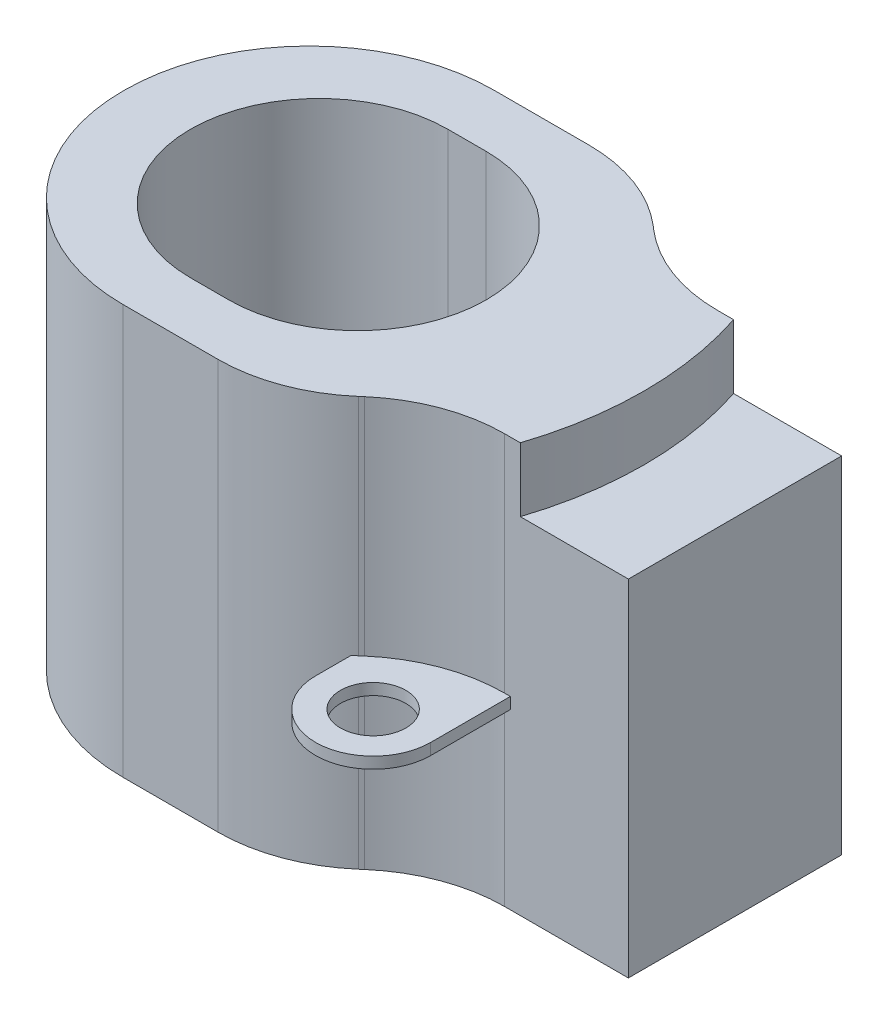
from build123d import *

# Parameters (mm, degrees)
BOSS_EXTRUDE1_DEPTH = 28.8
CUT_EXTRUDE1_DEPTH  = 43.16814556
CUT_EXTRUDE2_DEPTH  = 4.5
SKETCH4_R           = 2.3
BOSS_EXTRUDE2_DEPTH = 0.8


with BuildPart() as part:
    # Sketch1 → Boss-Extrude1 (new body)
    with BuildSketch(Plane(origin=(0, 0, 0), x_dir=(1, 0, 0), z_dir=(0, 1, 0))):
        with BuildLine():
            Line((12.001949565, -10.177539796), (11.776416687, -10.372460204))
            ThreePointArc((11.776416687, -10.372460204), (8.421105083, -12.358905428), (4.583596924, -13.05))
            Line((4.583596924, -13.05), (-2.1, -13.05))
            ThreePointArc((-2.1, -13.05), (-11.292388155, -9.242388155), (-15.1, -0.05))
            Line((-15.1, -0.05), (-15.1, 0.05))
            ThreePointArc((-15.1, 0.05), (-11.292388155, 9.242388155), (-2.1, 13.05))
            Line((-2.1, 13.05), (4.583596924, 13.05))
            ThreePointArc((4.583596924, 13.05), (8.421105083, 12.358905428), (11.776416687, 10.372460204))
            Line((11.776416687, 10.372460204), (12.001949565, 10.177539796))
            ThreePointArc((12.001949565, 10.177539796), (15.357261169, 8.191094572), (19.194769328, 7.5))
            Line((19.194769328, 7.5), (27.9, 7.5))
            Line((27.9, 7.5), (27.9, -7.5))
            Line((27.9, -7.5), (19.194769328, -7.5))
            ThreePointArc((19.194769328, -7.5), (15.357261169, -8.191094572), (12.001949565, -10.177539796))
        make_face()
    extrude(amount=-BOSS_EXTRUDE1_DEPTH)

    # Sketch2 → Cut-Extrude1 (cut, through all)
    with BuildSketch(Plane(origin=(0, 0, 0), x_dir=(1, 0, 0), z_dir=(0, 1, 0))):
        with BuildLine():
            Line((1.35, -9.05), (-1.35, -9.05))
            ThreePointArc((-1.35, -9.05), (-10.4, 0), (-1.35, 9.05))
            Line((-1.35, 9.05), (1.35, 9.05))
            ThreePointArc((1.35, 9.05), (10.4, 0), (1.35, -9.05))
        make_face()
    extrude(amount=-CUT_EXTRUDE1_DEPTH, mode=Mode.SUBTRACT)

    # Sketch3 → Cut-Extrude2 (cut)
    with BuildSketch(Plane(origin=(0, 0, 0), x_dir=(1, 0, 0), z_dir=(0, 1, 0))):
        with BuildLine():
            Line((27.9, 7.5), (20.3, 7.5))
            ThreePointArc((20.3, 7.5), (21.5, 0), (20.3, -7.5))
            Line((20.3, -7.5), (27.9, -7.5))
            Line((27.9, -7.5), (27.9, 7.5))
        make_face()
    extrude(amount=-CUT_EXTRUDE2_DEPTH, mode=Mode.SUBTRACT)

    # Sketch4 → Boss-Extrude2 (add)
    with BuildSketch(Plane(origin=(0, -15.8, 0), x_dir=(1, 0, 0), z_dir=(0, 1, 0))):
        with BuildLine():
            Line((19.6, 13.1), (19.6, -13.1))
            ThreePointArc((19.6, -13.1), (15.55, -17.15), (11.5, -13.1))
            Line((11.5, -13.1), (11.5, 13.1))
            ThreePointArc((11.5, 13.1), (15.55, 17.15), (19.6, 13.1))
        make_face()
        with Locations((15.55, 13.1)):
            Circle(SKETCH4_R, mode=Mode.SUBTRACT)
        with Locations((15.55, -13.1)):
            Circle(SKETCH4_R, mode=Mode.SUBTRACT)
    extrude(amount=-BOSS_EXTRUDE2_DEPTH)


solid = part.part
